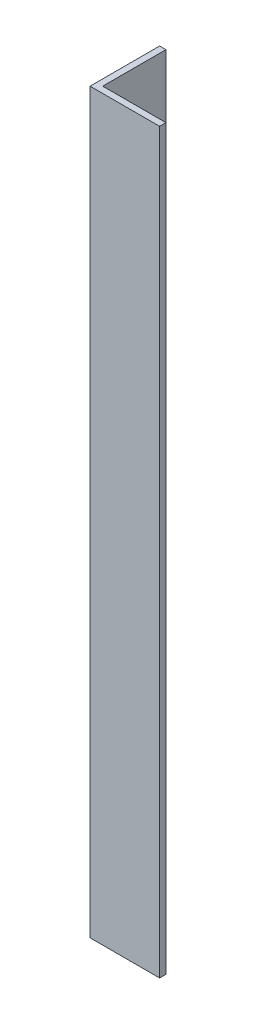
from build123d import *

# Parameters (mm, degrees)
EXTRUDE_1_DEPTH = 350


with BuildPart() as part:
    # Эскиз1 → Вытянуть-Тонкостенный1 (new body)
    with BuildSketch(Plane(origin=(0, 0, 0), x_dir=(1, 0, 0), z_dir=(0, 1, 0))):
        Polygon((0, 33), (0, 0), (33, 0), (33, 3), (3, 3), (3, 33), align=None)
    extrude(amount=EXTRUDE_1_DEPTH)


solid = part.part
